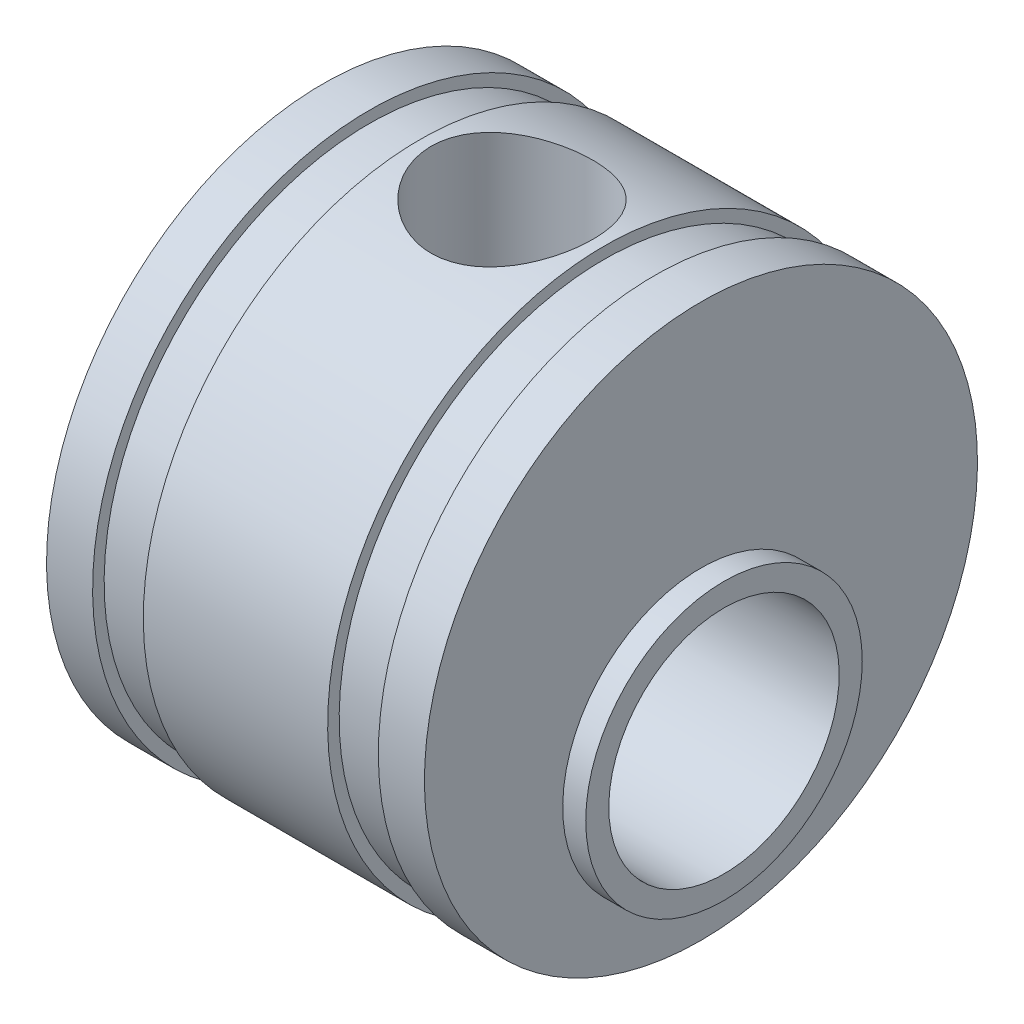
from build123d import *

# Parameters (mm, degrees)
CUT_EXTRUDE1_REACH  = 13.8
SKETCH4_R           = 2.5
CUT_EXTRUDE2_REACH  = 17.724
SKETCH5_R           = 1.7526
BOSS_EXTRUDE1_START = 0.5
SKETCH6_R           = 3
SKETCH6_R_2         = 2.5
BOSS_EXTRUDE1_DEPTH = 0.5


with BuildPart() as part:
    # Sketch3 → Revolve1 (revolve)
    with BuildSketch(Plane.XY):
        Polygon((0, 0), (0, 6), (1, 6), (1, 5.75), (2.1, 5.75), (2.1, 6), (6.1, 6), (6.1, 5.75), (7.2, 5.75), (7.2, 6), (8.2, 6), (8.2, 0), align=None)
    revolve(axis=Axis((0, 0, 0), (1, 0, 0)))

    # Sketch4 → Cut-Extrude1 (cut, up to next)
    with BuildSketch(Plane(origin=(8.2, 0, 0), x_dir=(0, 0, -1), z_dir=(1, 0, 0)), mode=Mode.PRIVATE) as cut_extrude1_sk1:
        with Locations((0, -2)):
            Circle(SKETCH4_R)
    cut_extrude1_tool1 = extrude(cut_extrude1_sk1.sketch, amount=-CUT_EXTRUDE1_REACH, mode=Mode.PRIVATE) & part.part
    add(cut_extrude1_tool1.solids().sort_by_distance((8.2, -2, 0))[0], mode=Mode.SUBTRACT)

    # Sketch5 → Cut-Extrude2 (cut, up to next)
    with BuildSketch(Plane(origin=(0, 6, 0), x_dir=(1, 0, 0), z_dir=(0, 1, 0)), mode=Mode.PRIVATE) as cut_extrude2_sk1:
        with Locations((4.1, 0)):
            Circle(SKETCH5_R)
    cut_extrude2_tool1 = extrude(cut_extrude2_sk1.sketch, amount=-CUT_EXTRUDE2_REACH, mode=Mode.PRIVATE) & part.part
    add(cut_extrude2_tool1.solids().sort_by_distance((4.1, 6, 0))[0], mode=Mode.SUBTRACT)

    # Sketch6 → Boss-Extrude1 (add)
    with BuildSketch(Plane(origin=(8.2, 0, 0), x_dir=(0, 0, -1), z_dir=(1, 0, 0)).offset(BOSS_EXTRUDE1_START)):
        with Locations((0, -2)):
            Circle(SKETCH6_R)
        with Locations((0, -2)):
            Circle(SKETCH6_R_2, mode=Mode.SUBTRACT)
    extrude(amount=-BOSS_EXTRUDE1_DEPTH)


solid = part.part
